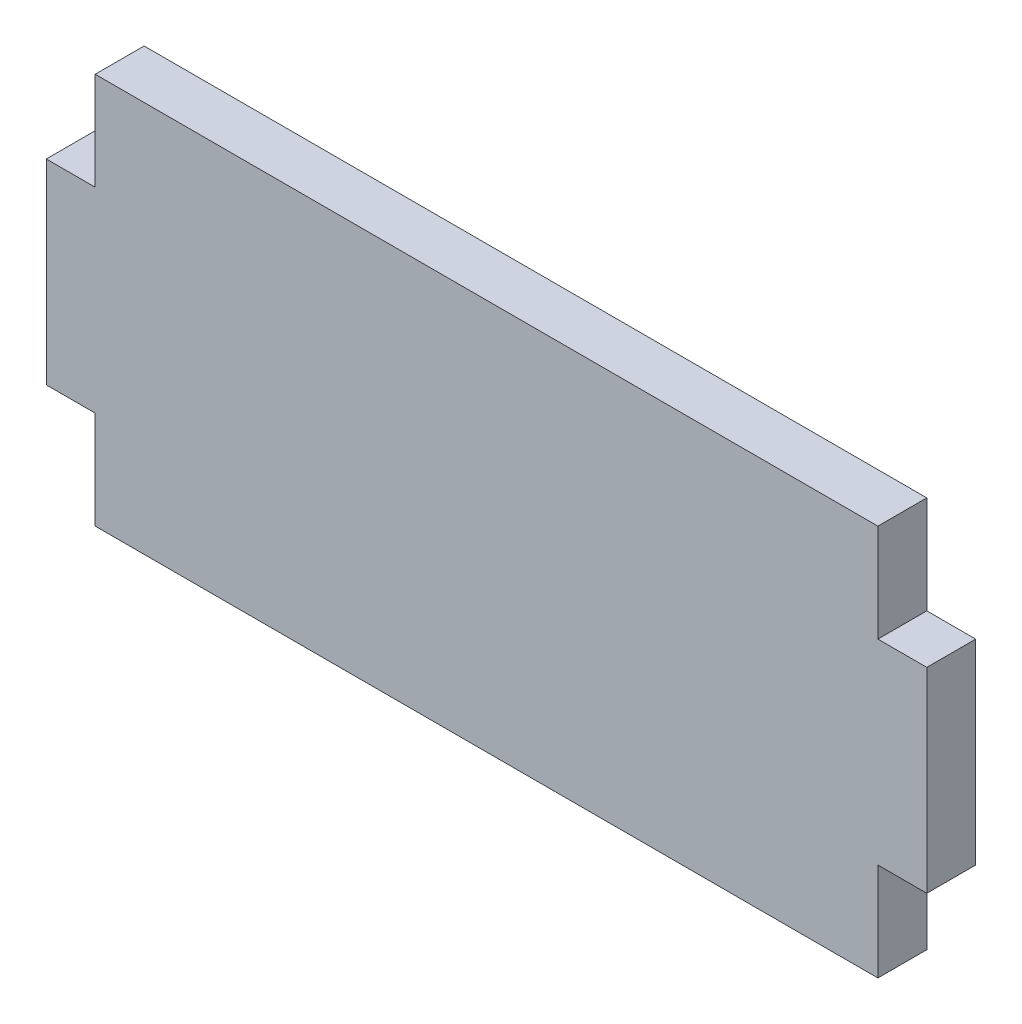
from build123d import *

# Parameters (mm, degrees)
SKETCH1_W           = 50.8
SKETCH1_H           = 25.4
BOSS_EXTRUDE1_DEPTH = 3.175
SKETCH2_W           = 3.175
SKETCH2_H           = 12.7
BOSS_EXTRUDE2_DEPTH = 3.175


with BuildPart() as part:
    # Sketch1 → Boss-Extrude1 (new body)
    with BuildSketch(Plane.XY):
        with Locations((25.4, 12.7)):
            Rectangle(SKETCH1_W, SKETCH1_H)
    extrude(amount=BOSS_EXTRUDE1_DEPTH)

    # Sketch2 → Boss-Extrude2 (add)
    with BuildSketch(Plane.XY.offset(3.175)):
        with Locations((-1.5875, 12.7)):
            Rectangle(SKETCH2_W, SKETCH2_H)
        with Locations((52.3875, 12.7)):
            Rectangle(SKETCH2_W, SKETCH2_H)
    extrude(amount=-BOSS_EXTRUDE2_DEPTH)


solid = part.part
